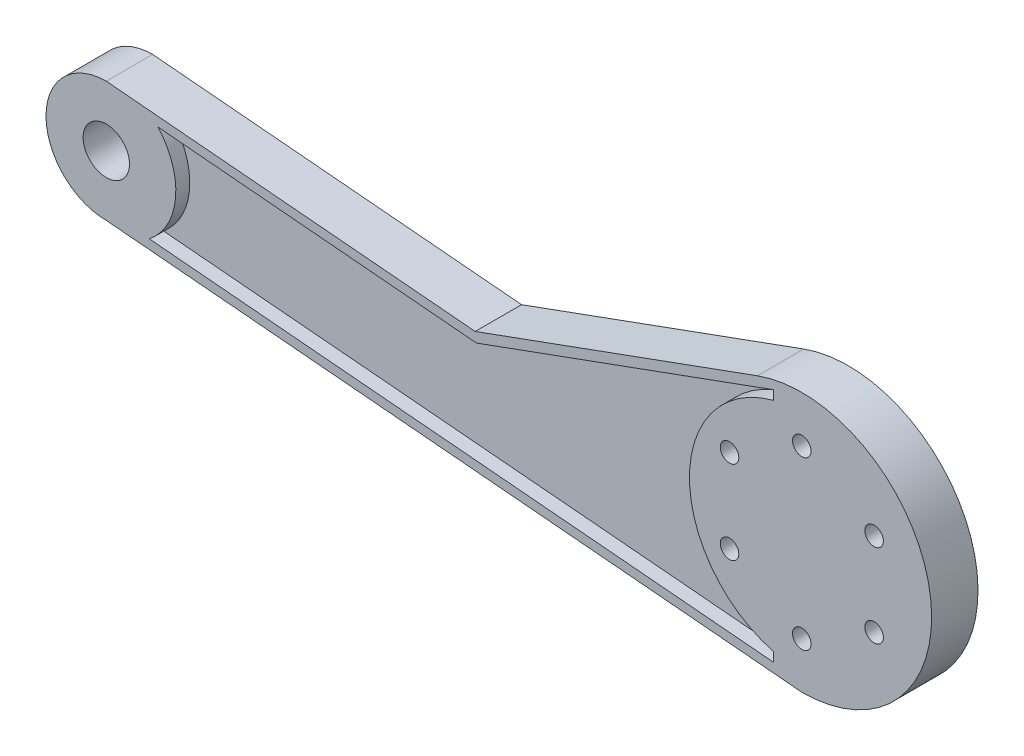
from build123d import *

# Parameters (mm, degrees)
SKETCH1_R           = 5
BOSS_EXTRUDE1_DEPTH = 10
CUT_EXTRUDE2_DEPTH  = 3
SKETCH4_R           = 2
CUT_EXTRUDE3_DEPTH  = 166.677906034


with BuildPart() as part:
    # Sketch1 → Boss-Extrude1 (new body)
    with BuildSketch(Plane(origin=(0, 0, 0), x_dir=(-1, 0, 0), z_dir=(0, 0, 1))):
        with BuildLine():
            Line((149.988246655, -11.122271244), (70.431611349, -4.161967547))
            Line((70.431611349, -4.161967547), (9.576564013, -26.311393382))
            ThreePointArc((9.576564013, -26.311393382), (-27.574617084, -4.862148975), (0, 28))
            Line((0, 28), (149.988246655, 14.877728756))
            ThreePointArc((149.988246655, 14.877728756), (162.988246655, 1.877728756), (149.988246655, -11.122271244))
        make_face()
        with Locations((149.988246655, 1.877728756)):
            Circle(SKETCH1_R, mode=Mode.SUBTRACT)
    extrude(amount=BOSS_EXTRUDE1_DEPTH)

    # Sketch3 → Cut-Extrude2 (cut)
    with BuildSketch(Plane.XY.offset(10)):
        with BuildLine():
            Line((-138.821713772, 8.137686531), (-70.164220739, 2.130934225))
            Line((-70.164220739, 2.130934225), (-6.062833609, 25.461931115))
            Line((-6.062833609, 25.461931115), (-6.062833609, 23.461931115))
            ThreePointArc((-6.062833609, 23.461931115), (-24.232626004, 0), (-6.062833609, -23.461931115))
            Line((-6.062833609, -23.461931115), (-6.062833609, -25.461931115))
            Line((-6.062833609, -25.461931115), (-140.730517111, -13.680035466))
            ThreePointArc((-140.730517111, -13.680035466), (-135.045326184, -3.185064897), (-138.821713772, 8.137686531))
        make_face()
    extrude(amount=-CUT_EXTRUDE2_DEPTH, mode=Mode.SUBTRACT)

    # Sketch4 → Cut-Extrude3 (cut, through all)
    with BuildSketch(Plane.XY.offset(10)):
        with Locations((0, 18)):
            Circle(SKETCH4_R)
        with Locations((15.588457268, 9)):
            Circle(SKETCH4_R)
        with Locations((15.588457268, -9)):
            Circle(SKETCH4_R)
        with Locations((0, -18)):
            Circle(SKETCH4_R)
        with Locations((-15.588457268, -9)):
            Circle(SKETCH4_R)
        with Locations((-15.588457268, 9)):
            Circle(SKETCH4_R)
    extrude(amount=-CUT_EXTRUDE3_DEPTH, mode=Mode.SUBTRACT)


solid = part.part
